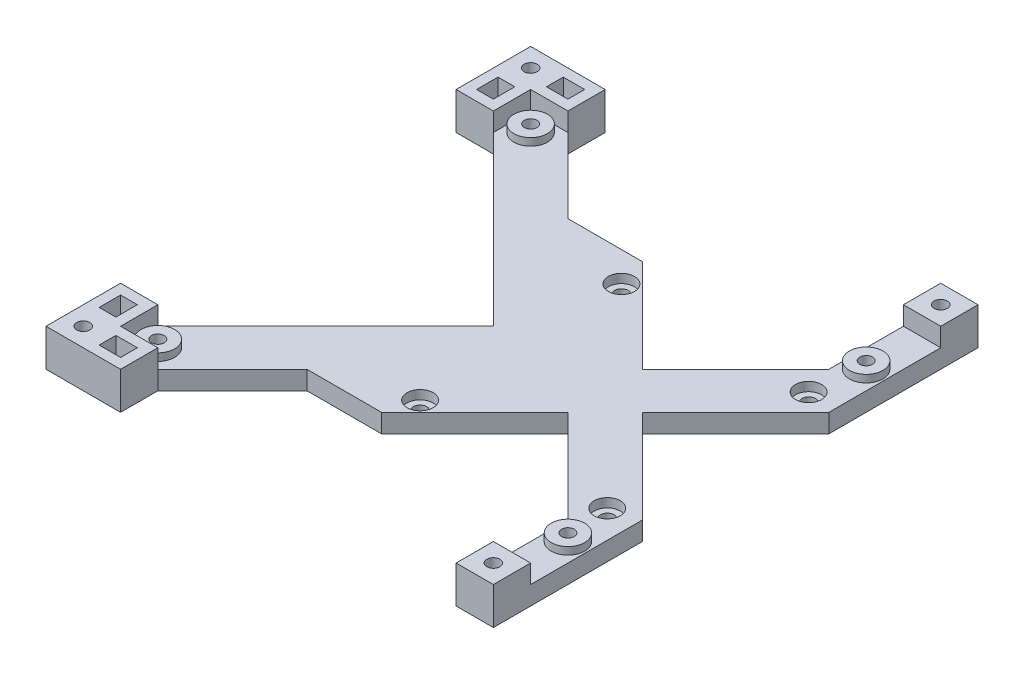
from build123d import *

# Parameters (mm, degrees)
BOSS_EXTRU_1_DEPTH                                 = 5
ESQUISSE2_W                                        = 10
ESQUISSE2_H                                        = 10
BOSS_EXTRU_2_DEPTH                                 = 10
ESQUISSE3_R                                        = 4.5
BOSS_EXTRU_3_DEPTH                                 = 2
D_GAGEMENT_M31_D                                   = 3.4
CHAMBRAGE_POUR_VIS_T_TE_RONDE_BOMB_E_M_D           = 3.6
CHAMBRAGE_POUR_VIS_T_TE_RONDE_BOMB_E_M_CBORE_D     = 7
CHAMBRAGE_POUR_VIS_T_TE_RONDE_BOMB_E_M_CBORE_DEPTH = 2.4
ESQUISSE11_R                                       = 1.75
ENL_V_MAT_EXTRU_1_DEPTH                            = 10
ESQUISSE14_W                                       = 5.75
ESQUISSE14_H                                       = 4.5
ESQUISSE14_W_2                                     = 4.5
ESQUISSE14_H_2                                     = 5.75
ENL_V_MAT_EXTRU_2_DEPTH                            = 5


with BuildPart() as part:
    # Esquisse1 → Boss.-Extru.1 (new body)
    with BuildSketch(Plane(origin=(0, 0, 0), x_dir=(1, 0, 0), z_dir=(0, 1, 0))):
        Polygon((-25, -35), (-5, -35), (20, -10), (45, -35), (45, -55), (55, -55), (55, -35), (55, -25), (30, 0), (55, 25), (55, 35), (55, 55), (45, 55), (45, 35), (20, 10), (-5, 35), (-25, 35), (-45, 55), (-55, 55), (-55, 45), (-10.084003782, 0.084003782), (-10.084003782, -0.084003782), (-55, -45), (-55, -55), (-45, -55), align=None)
    extrude(amount=BOSS_EXTRU_1_DEPTH)

    # Esquisse2 → Boss.-Extru.2 (add)
    with BuildSketch(Plane(origin=(0, 0, 0), x_dir=(1, 0, 0), z_dir=(0, 1, 0))):
        Polygon((-55, -45), (-65, -45), (-65, -65), (-45, -65), (-45, -55), (-55, -55), align=None)
        Polygon((-45, 65), (-45, 55), (-55, 55), (-55, 45), (-65, 45), (-65, 65), align=None)
        with Locations((50, 60)):
            Rectangle(ESQUISSE2_W, ESQUISSE2_H)
        with Locations((50, -60)):
            Rectangle(ESQUISSE2_W, ESQUISSE2_H)
    extrude(amount=BOSS_EXTRU_2_DEPTH)

    # Esquisse3 → Boss.-Extru.3 (add)
    with BuildSketch(Plane(origin=(0, 5, 0), x_dir=(1, 0, 0), z_dir=(0, 1, 0))):
        with Locations((-50, -50)):
            Circle(ESQUISSE3_R)
        with Locations((-50, 50)):
            Circle(ESQUISSE3_R)
        with Locations((50, 40)):
            Circle(ESQUISSE3_R)
        with Locations((50, -40)):
            Circle(ESQUISSE3_R)
    extrude(amount=BOSS_EXTRU_3_DEPTH)

    # Dégagement M31 (through all)
    with Locations(Plane(origin=(-50, 7, -50), x_dir=(0, 0, 1), z_dir=(0, 1, 0))):
        with Locations((0, 0), (10, 100), (90, 100), (100, 0)):
            Hole(D_GAGEMENT_M31_D / 2)

    # Chambrage pour vis à tête ronde bombée M32 (through all)
    with Locations(Plane(origin=(-2.645831921, 5, -27), x_dir=(0, 0, 1), z_dir=(0, 1, 0))):
        with Locations((0, 0), (54, 0), (54, 50.20766006), (0, 50.20766006)):
            CounterBoreHole(CHAMBRAGE_POUR_VIS_T_TE_RONDE_BOMB_E_M_D / 2, CHAMBRAGE_POUR_VIS_T_TE_RONDE_BOMB_E_M_CBORE_D / 2, CHAMBRAGE_POUR_VIS_T_TE_RONDE_BOMB_E_M_CBORE_DEPTH)

    # Esquisse11 → Enlèv. mat.-Extru.1 (cut)
    with BuildSketch(Plane(origin=(0, 10, 0), x_dir=(1, 0, 0), z_dir=(0, 1, 0))):
        with Locations((-60, 60)):
            Circle(ESQUISSE11_R)
        with Locations((50, 60)):
            Circle(ESQUISSE11_R)
        with Locations((50, -60)):
            Circle(ESQUISSE11_R)
        with Locations((-60, -60)):
            Circle(ESQUISSE11_R)
    extrude(amount=-ENL_V_MAT_EXTRU_1_DEPTH, mode=Mode.SUBTRACT)

    # Esquisse14 → Enlèv. mat.-Extru.2 (cut)
    with BuildSketch(Plane(origin=(0, 10, 0), x_dir=(1, 0, 0), z_dir=(0, 1, 0))):
        with Locations((-50.625, 60)):
            Rectangle(ESQUISSE14_W, ESQUISSE14_H)
        with Locations((-60, 50.625)):
            Rectangle(ESQUISSE14_W_2, ESQUISSE14_H_2)
        with Locations((-60, -50.625)):
            Rectangle(ESQUISSE14_W_2, ESQUISSE14_H_2)
        with Locations((-50.625, -60)):
            Rectangle(ESQUISSE14_W, ESQUISSE14_H)
    extrude(amount=-ENL_V_MAT_EXTRU_2_DEPTH, mode=Mode.SUBTRACT)


solid = part.part
